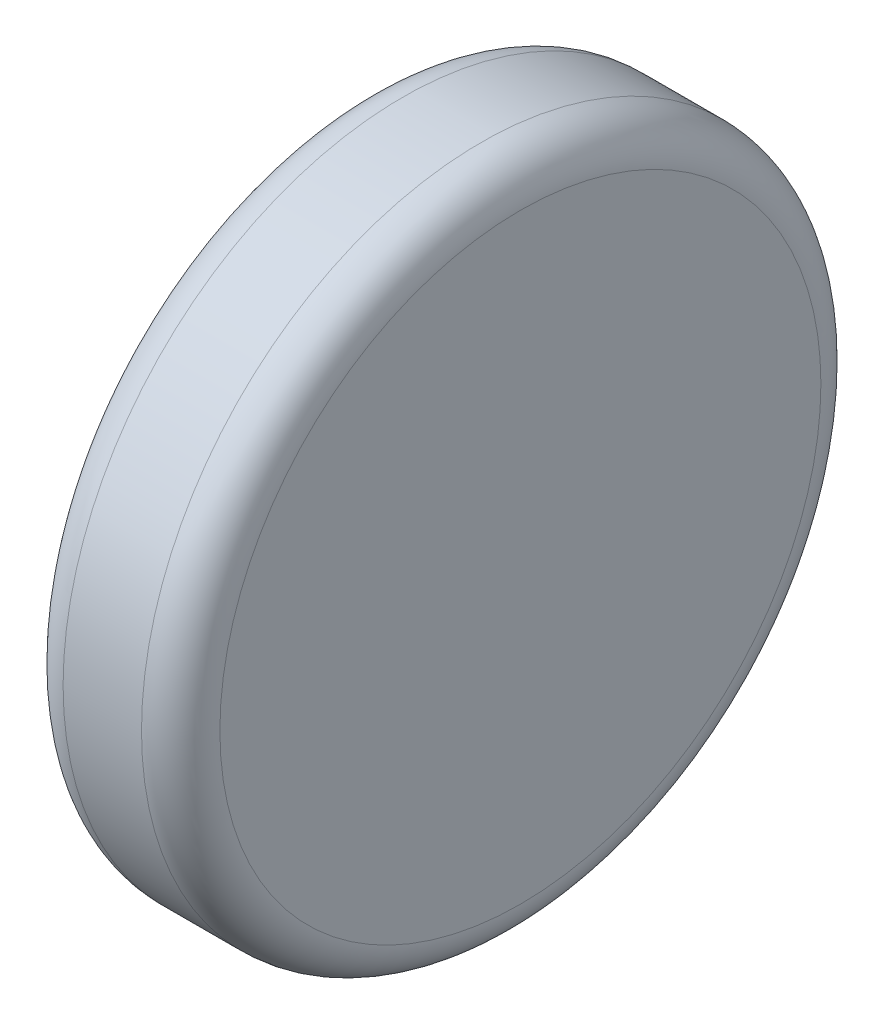
from build123d import *

# Parameters (mm, degrees)
BOSS_EXTRUDE1_START     = -76.2
BOSS_EXTRUDE1_OUTLINE_R = 330.2
BOSS_EXTRUDE1_DEPTH     = 152.4
FILLET3_R               = 38.1


with BuildPart() as part:
    # Boss-Extrude1: read off the stored shape, not the designer's step
    # Boss-Extrude1 outline → Boss-Extrude1 (new body)
    with BuildSketch(Plane(origin=(0, 0, 0), x_dir=(0, 0, -1), z_dir=(1, 0, 0)).offset(BOSS_EXTRUDE1_START)):
        with Locations((-1825.769738141, 549.184340599)):
            Circle(BOSS_EXTRUDE1_OUTLINE_R)
    extrude(amount=BOSS_EXTRUDE1_DEPTH)

    # Fillet3
    fillet3_edges = [part.edges().sort_by_distance(p)[0] for p in [
        (76.2, 549.184340599, 2155.969738141),
        (-76.2, 549.184340599, 2155.969738141),
    ]]
    fillet(fillet3_edges, radius=FILLET3_R)


solid = part.part
